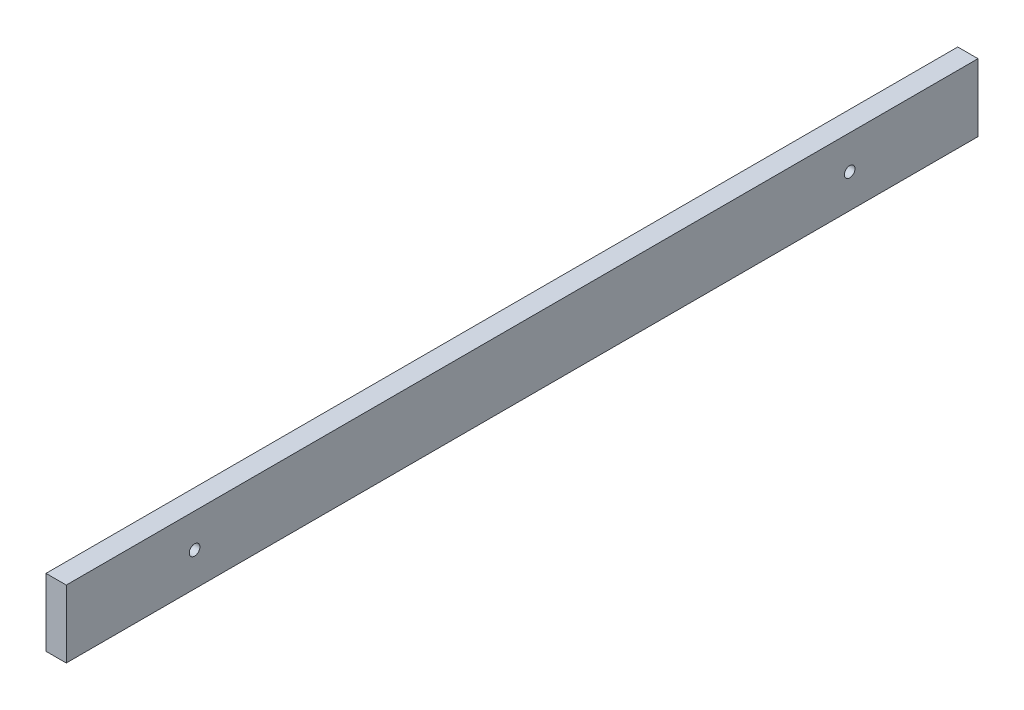
from build123d import *

# Parameters (mm, degrees)
CROQUIS1_W              = 270
CROQUIS1_H              = 20
CROQUIS1_R              = 1.58
SALIENTE_EXTRUIR1_DEPTH = 6


with BuildPart() as part:
    # Croquis1 → Saliente-Extruir1 (new body)
    with BuildSketch(Plane(origin=(0, 0, 0), x_dir=(0, 0, -1), z_dir=(1, 0, 0))):
        Rectangle(CROQUIS1_W, CROQUIS1_H)
        with Locations((97, 0)):
            Circle(CROQUIS1_R, mode=Mode.SUBTRACT)
        with Locations((-97, 0)):
            Circle(CROQUIS1_R, mode=Mode.SUBTRACT)
    extrude(amount=SALIENTE_EXTRUIR1_DEPTH)


solid = part.part
